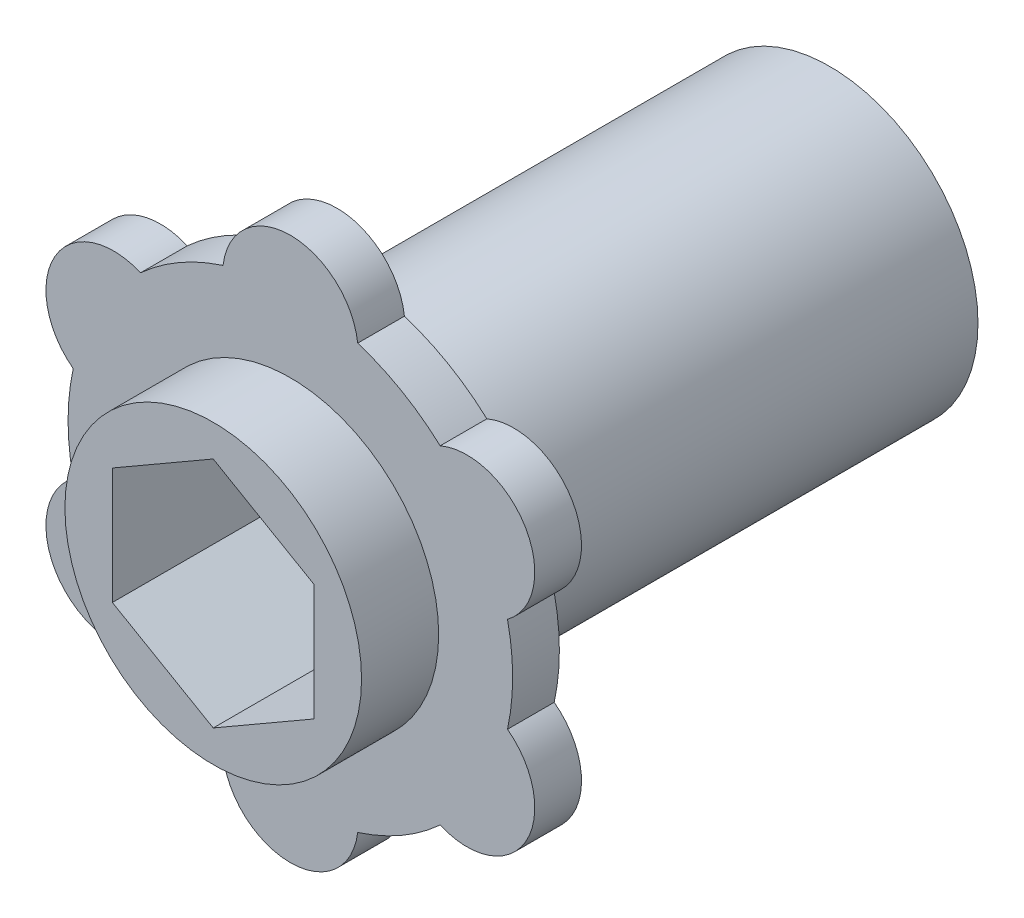
from build123d import *

# Parameters (mm, degrees)
BOSS_EXTRUDE1_DEPTH = 1.49987
SKETCH2_R           = 9.525
BOSS_EXTRUDE2_DEPTH = 4.953
BOSS_EXTRUDE3_START = 31.63316
SKETCH3_R           = 9.525
BOSS_EXTRUDE3_DEPTH = 31.63316


with BuildPart() as part:
    # Sketch1 → Boss-Extrude1 (new, symmetric)
    with BuildSketch(Plane.XY):
        with BuildLine():
            ThreePointArc((-13.943369395, 3.058163658), (-14.2748, 0), (-13.943369395, -3.058163658))
            ThreePointArc((-13.943369395, -3.058163658), (-15.111970091, -8.7249), (-9.620132114, -10.546230281))
            ThreePointArc((-9.620132114, -10.546230281), (-7.1374, -12.362339434), (-4.32323728, -13.604393939))
            ThreePointArc((-4.32323728, -13.604393939), (0, -17.4498), (4.32323728, -13.604393939))
            ThreePointArc((4.32323728, -13.604393939), (7.1374, -12.362339434), (9.620132114, -10.546230281))
            ThreePointArc((9.620132114, -10.546230281), (15.111970091, -8.7249), (13.943369395, -3.058163658))
            ThreePointArc((13.943369395, -3.058163658), (14.2748, 0), (13.943369395, 3.058163658))
            ThreePointArc((13.943369395, 3.058163658), (15.111970091, 8.7249), (9.620132114, 10.546230281))
            ThreePointArc((9.620132114, 10.546230281), (7.1374, 12.362339434), (4.32323728, 13.604393939))
            ThreePointArc((4.32323728, 13.604393939), (0, 17.4498), (-4.32323728, 13.604393939))
            ThreePointArc((-4.32323728, 13.604393939), (-7.1374, 12.362339434), (-9.620132114, 10.546230281))
            ThreePointArc((-9.620132114, 10.546230281), (-15.111970091, 8.7249), (-13.943369395, 3.058163658))
        make_face()
        Polygon((0, 7.478995387), (-6.477, 3.739497694), (-6.477, -3.739497694), (0, -7.478995387), (6.477, -3.739497694), (6.477, 3.739497694), align=None, mode=Mode.SUBTRACT)
    extrude(amount=BOSS_EXTRUDE1_DEPTH, both=True)

    # Sketch2 → Boss-Extrude2 (add)
    with BuildSketch(Plane.XY.offset(1.49987)):
        Circle(SKETCH2_R)
        Polygon((0, 7.478995387), (-6.477, 3.739497694), (-6.477, -3.739497694), (0, -7.478995387), (6.477, -3.739497694), (6.477, 3.739497694), align=None, mode=Mode.SUBTRACT)
    extrude(amount=BOSS_EXTRUDE2_DEPTH)

    # Sketch3 → Boss-Extrude3 (add)
    with BuildSketch(Plane(origin=(0, 0, -1.49987), x_dir=(-1, 0, 0), z_dir=(0, 0, -1)).offset(BOSS_EXTRUDE3_START)):
        Circle(SKETCH3_R)
        Polygon((0, 7.478995387), (-6.477, 3.739497694), (-6.477, -3.739497694), (0, -7.478995387), (6.477, -3.739497694), (6.477, 3.739497694), align=None, mode=Mode.SUBTRACT)
    extrude(amount=-BOSS_EXTRUDE3_DEPTH)


solid = part.part
